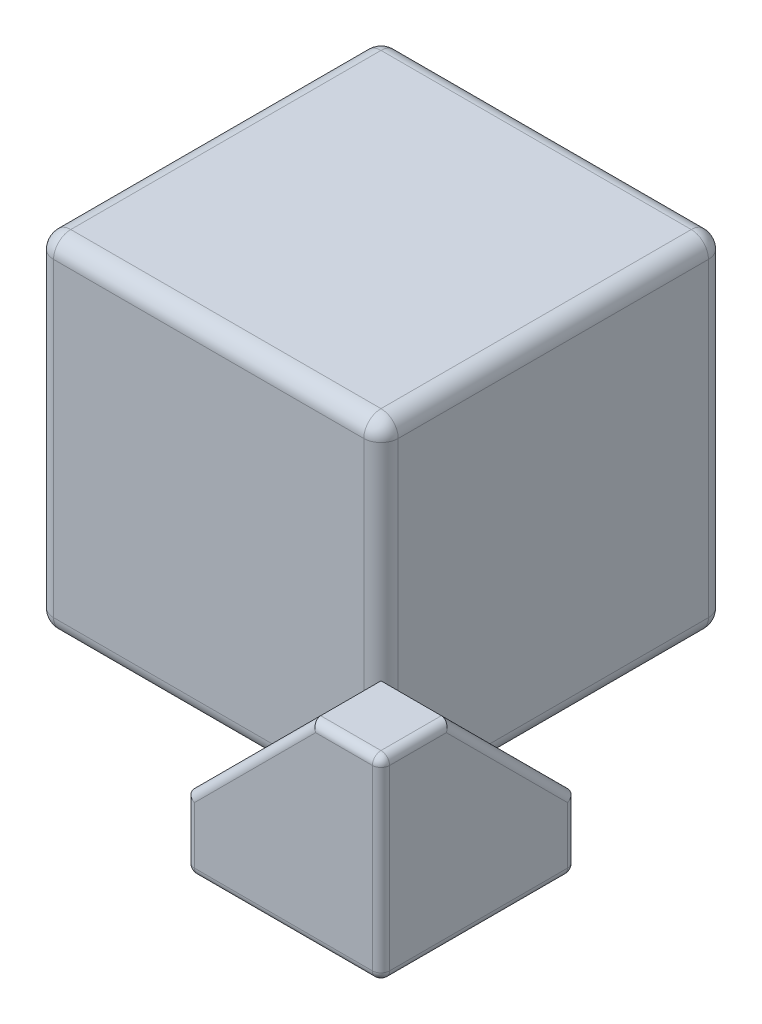
from build123d import *

# Parameters (mm, degrees)
IZIM1_W                     = 20
IZIM1_H                     = 20
Y_KSEKLIK_EKSTR_ZYON1_DEPTH = 10
BO_ALTMA1_T                 = -1
Y_KSEKLIK_EKSTR_ZYON3_DEPTH = 4
Y_KSEKLIK_EKSTR_ZYON4_DEPTH = 4
Y_KSEKLIK_EKSTR_ZYON5_REACH = 33.113
RADYUS1_R                   = 1
RADYUS2_R                   = 1
RADYUS3_R                   = 0.5
KES_EKSTR_ZYON1_DEPTH       = 3.5


with BuildPart() as part:
    # Çizim1 → Yükseklik-Ekstrüzyon1 (new, symmetric)
    with BuildSketch(Plane.XY):
        Rectangle(IZIM1_W, IZIM1_H)
    extrude(amount=Y_KSEKLIK_EKSTR_ZYON1_DEPTH, both=True)

    # İç Boşaltma1
    bo_altma1_openings = [part.faces().sort_by_distance(p)[0] for p in [
        (0, -10, 0),
    ]]
    offset(amount=BO_ALTMA1_T, openings=bo_altma1_openings, kind=Kind.INTERSECTION)

    # Çizim6 → Yükseklik-Ekstrüzyon3 (add)
    with BuildSketch(Plane(origin=(10, 0, 0), x_dir=(0, 0, -1), z_dir=(1, 0, 0))):
        Polygon((-2.679491924, -10), (-10, -2.679491924), (-10, -10), align=None)
        Polygon((-10, -10), (-10, -2.679491924), (-14, -2.679491924), (-14, -14), (-2.679491924, -14), (-2.679491924, -10), align=None)
    extrude(amount=Y_KSEKLIK_EKSTR_ZYON3_DEPTH)

    # Çizim7 → Yükseklik-Ekstrüzyon4 (add)
    with BuildSketch(Plane.XY.offset(10)):
        Polygon((10, -2.679491924), (2.679491924, -10), (2.679491924, -14), (10, -14), align=None)
    extrude(amount=Y_KSEKLIK_EKSTR_ZYON4_DEPTH)

    # Yükseklik-Ekstrüzyon5: up to this face of the body (flat: up to its plane)
    y_kseklik_ekstr_zyon5_end = Plane(part.part.faces().sort_by_distance((0, 9, 0))[0])
    # Çizim8 → Yükseklik-Ekstrüzyon5 (add, up to the picked face)
    with BuildSketch(Plane.XZ.offset(14), mode=Mode.PRIVATE) as y_kseklik_ekstr_zyon5_sk1:
        Polygon((10, 2.679491924), (2.679491924, 10), (10, 10), align=None)
    y_kseklik_ekstr_zyon5_tool1 = split(extrude(y_kseklik_ekstr_zyon5_sk1.sketch, amount=-Y_KSEKLIK_EKSTR_ZYON5_REACH, mode=Mode.PRIVATE), bisect_by=y_kseklik_ekstr_zyon5_end, keep=Keep.BOTH, mode=Mode.PRIVATE)
    add(y_kseklik_ekstr_zyon5_tool1.solids().sort_by(Axis((7.559831, -14, 7.559831), (0, 1, 0)))[0])

    # Radyus1
    # the kernel refuses this fillet: 1 mm, written as the material it takes off along each edge
    with BuildSketch(Plane(origin=(-9, 9, 9), x_dir=(0, 0, 1), z_dir=(-1, 0, 0))) as radyus1_piece_1_section:
        Polygon((0, 0), (RADYUS1_R, 0), (RADYUS1_R, RADYUS1_R), (0, RADYUS1_R), align=None)
    radyus1_piece_1 = extrude(amount=RADYUS1_R, mode=Mode.PRIVATE)
    radyus1_piece_1 = radyus1_piece_1 - Plane(origin=(-9, 9, 9), x_dir=(0, -0.7071067811865475, -0.7071067811865475), z_dir=(-1, 0, 0)) * Sphere(RADYUS1_R, mode=Mode.PRIVATE)
    add(radyus1_piece_1, mode=Mode.SUBTRACT)
    with BuildSketch(Plane(origin=(9, 9, 9), x_dir=(1, 0, 0), z_dir=(0, 0, 1))) as radyus1_piece_2_section:
        Polygon((0, 0), (RADYUS1_R, 0), (RADYUS1_R, RADYUS1_R), (0, RADYUS1_R), align=None)
    radyus1_piece_2 = extrude(amount=RADYUS1_R, mode=Mode.PRIVATE)
    radyus1_piece_2 = radyus1_piece_2 - Plane(origin=(9, 9, 9), x_dir=(-0.7071067811865475, -0.7071067811865475, 0), z_dir=(0, 0, 1)) * Sphere(RADYUS1_R, mode=Mode.PRIVATE)
    add(radyus1_piece_2, mode=Mode.SUBTRACT)
    with BuildSketch(Plane(origin=(-9, 9, -9), x_dir=(0, 1, 0), z_dir=(-1, 0, 0))) as radyus1_piece_3_section:
        Polygon((0, 0), (RADYUS1_R, 0), (RADYUS1_R, RADYUS1_R), (0, RADYUS1_R), align=None)
    radyus1_piece_3 = extrude(amount=RADYUS1_R, mode=Mode.PRIVATE)
    radyus1_piece_3 = radyus1_piece_3 - Plane(origin=(-9, 9, -9), x_dir=(0, -0.7071067811865475, 0.7071067811865475), z_dir=(-1, 0, 0)) * Sphere(RADYUS1_R, mode=Mode.PRIVATE)
    add(radyus1_piece_3, mode=Mode.SUBTRACT)
    with BuildSketch(Plane(origin=(9, 9, -9), x_dir=(1, 0, 0), z_dir=(0, 1, 0))) as radyus1_piece_4_section:
        Polygon((0, 0), (RADYUS1_R, 0), (RADYUS1_R, RADYUS1_R), (0, RADYUS1_R), align=None)
    radyus1_piece_4 = extrude(amount=RADYUS1_R, mode=Mode.PRIVATE)
    radyus1_piece_4 = radyus1_piece_4 - Plane(origin=(9, 9, -9), x_dir=(-0.7071067811865475, 0, 0.7071067811865475), z_dir=(0, 1, 0)) * Sphere(RADYUS1_R, mode=Mode.PRIVATE)
    add(radyus1_piece_4, mode=Mode.SUBTRACT)
    with BuildSketch(Plane(origin=(-10, 9, 10), x_dir=(0, 0, -1), z_dir=(0, -1, 0))) as radyus1_piece_5:
        with BuildLine():
            CenterArc((RADYUS1_R, RADYUS1_R), RADYUS1_R, 180, 90)
            Line((0, RADYUS1_R), (0, 0))
            Line((0, 0), (RADYUS1_R, 0))
        make_face()
    extrude(amount=21.5, mode=Mode.SUBTRACT)
    with BuildSketch(Plane(origin=(10, -5.179491924, 10), x_dir=(0, 0, -1), z_dir=(0, 1, 0))) as radyus1_piece_6_section:
        with BuildLine():
            CenterArc((RADYUS1_R, RADYUS1_R), RADYUS1_R, 180, 90)
            Line((0, RADYUS1_R), (0, 0))
            Line((0, 0), (RADYUS1_R, 0))
        make_face()
    radyus1_piece_6 = extrude(amount=14.179491924, mode=Mode.PRIVATE)
    radyus1_piece_6 = split(radyus1_piece_6, bisect_by=Plane(origin=(9.471072473, -2.843960274, 9.83553165), z_dir=(0, -0.7071067811865475, 0.7071067811865477)), keep=Keep.TOP, mode=Mode.PRIVATE)
    radyus1_piece_6 = split(radyus1_piece_6, bisect_by=Plane(origin=(9.592558865, -3.086933059, 9.957018042), z_dir=(-0.7071067811865479, 0.7071067811865472, 0)), keep=Keep.TOP, mode=Mode.PRIVATE)
    add(radyus1_piece_6, mode=Mode.SUBTRACT)
    with BuildSketch(Plane(origin=(10, -5.179491924, 10), x_dir=(0, 0, -1), z_dir=(0, 1, 0))) as radyus1_piece_7_section:
        with BuildLine():
            CenterArc((RADYUS1_R, RADYUS1_R), RADYUS1_R, 180, 90)
            Line((0, RADYUS1_R), (0, 0))
            Line((0, 0), (RADYUS1_R, 0))
        make_face()
    radyus1_piece_7 = extrude(amount=14.179491924, mode=Mode.PRIVATE)
    radyus1_piece_7 = split(radyus1_piece_7, bisect_by=Plane(origin=(9.957018042, -3.086933059, 9.592558865), z_dir=(0, 0.7071067811865475, -0.7071067811865477)), keep=Keep.TOP, mode=Mode.PRIVATE)
    radyus1_piece_7 = split(radyus1_piece_7, bisect_by=Plane(origin=(9.83553165, -2.843960274, 9.471072473), z_dir=(0.7071067811865479, -0.7071067811865472, 0)), keep=Keep.TOP, mode=Mode.PRIVATE)
    add(radyus1_piece_7, mode=Mode.SUBTRACT)
    with BuildSketch(Plane(origin=(10, -5.179491924, 10), x_dir=(0, 0, -1), z_dir=(0, 1, 0))) as radyus1_piece_8_section:
        with BuildLine():
            CenterArc((RADYUS1_R, RADYUS1_R), RADYUS1_R, 180, 90)
            Line((0, RADYUS1_R), (0, 0))
            Line((0, 0), (RADYUS1_R, 0))
        make_face()
    radyus1_piece_8 = extrude(amount=14.179491924, mode=Mode.PRIVATE)
    radyus1_piece_8 = split(radyus1_piece_8, bisect_by=Plane(origin=(9.773566739, 0.108490737, 12.787982661), z_dir=(0, 0.7071067811865475, -0.7071067811865477)), keep=Keep.TOP, mode=Mode.PRIVATE)
    radyus1_piece_8 = split(radyus1_piece_8, bisect_by=Plane(origin=(12.787982661, 0.108490737, 9.773566739), z_dir=(-0.7071067811865479, 0.7071067811865472, 0)), keep=Keep.TOP, mode=Mode.PRIVATE)
    add(radyus1_piece_8, mode=Mode.SUBTRACT)
    with BuildSketch(Plane(origin=(-10, 9, -10), x_dir=(0, 0, 1), z_dir=(0, -1, 0)), Plane(origin=(10, -12.5, -10), x_dir=(0, 0, 1), z_dir=(0, 1, 0))) as radyus1_piece_9:
        with BuildLine():
            CenterArc((RADYUS1_R, -RADYUS1_R), RADYUS1_R, 90, 90)
            Line((0, -RADYUS1_R), (0, 0))
            Line((0, 0), (RADYUS1_R, 0))
        make_face()
    extrude(amount=21.5, mode=Mode.SUBTRACT)
    with BuildSketch(Plane(origin=(9, 10, -10), x_dir=(0, 0, 1), z_dir=(-1, 0, 0)), Plane(origin=(-10, 10, 9), x_dir=(0, -1, 0), z_dir=(0, 0, -1))) as radyus1_piece_10:
        with BuildLine():
            CenterArc((RADYUS1_R, -RADYUS1_R), RADYUS1_R, 90, 90)
            Line((0, -RADYUS1_R), (0, 0))
            Line((0, 0), (RADYUS1_R, 0))
        make_face()
    extrude(amount=18, mode=Mode.SUBTRACT)
    with BuildSketch(Plane(origin=(9, 10, 10), x_dir=(0, 0, -1), z_dir=(-1, 0, 0)), Plane(origin=(10, 10, -9), x_dir=(-1, 0, 0), z_dir=(0, 0, 1))) as radyus1_piece_11:
        with BuildLine():
            CenterArc((RADYUS1_R, RADYUS1_R), RADYUS1_R, 180, 90)
            Line((0, RADYUS1_R), (0, 0))
            Line((0, 0), (RADYUS1_R, 0))
        make_face()
    extrude(amount=18, mode=Mode.SUBTRACT)

    # Radyus2
    # the kernel refuses this fillet: 1 mm, written as the material it takes off along each edge
    with BuildSketch(Plane(origin=(-9, -10, 10), x_dir=(0, 0, -1), z_dir=(1, 0, 0))) as radyus2_piece_1_section:
        with BuildLine():
            CenterArc((RADYUS2_R, RADYUS2_R), RADYUS2_R, 180, 90)
            Line((0, RADYUS2_R), (0, 0))
            Line((0, 0), (RADYUS2_R, 0))
        make_face()
    radyus2_piece_1 = extrude(amount=14.179491924, mode=Mode.PRIVATE)
    radyus2_piece_1 = split(radyus2_piece_1, bisect_by=Plane(origin=(-0.108490737, -9.773566739, 12.787982661), z_dir=(-0.7071067811865476, 0, -0.7071067811865475)), keep=Keep.TOP, mode=Mode.PRIVATE)
    radyus2_piece_1 = split(radyus2_piece_1, bisect_by=Plane(origin=(-0.108490737, -12.787982661, 9.773566739), z_dir=(-0.7071067811865479, 0.7071067811865472, 0)), keep=Keep.TOP, mode=Mode.PRIVATE)
    add(radyus2_piece_1, mode=Mode.SUBTRACT)
    with BuildSketch(Plane(origin=(-9, -10, 10), x_dir=(0, 0, -1), z_dir=(1, 0, 0))) as radyus2_piece_2_section:
        with BuildLine():
            CenterArc((RADYUS2_R, RADYUS2_R), RADYUS2_R, 180, 90)
            Line((0, RADYUS2_R), (0, 0))
            Line((0, 0), (RADYUS2_R, 0))
        make_face()
    radyus2_piece_2 = extrude(amount=14.179491924, mode=Mode.PRIVATE)
    radyus2_piece_2 = split(radyus2_piece_2, bisect_by=Plane(origin=(2.843960274, -9.471072473, 9.83553165), z_dir=(0.7071067811865476, 0, 0.7071067811865475)), keep=Keep.TOP, mode=Mode.PRIVATE)
    radyus2_piece_2 = split(radyus2_piece_2, bisect_by=Plane(origin=(3.086933059, -9.592558865, 9.957018042), z_dir=(-0.7071067811865479, 0.7071067811865472, 0)), keep=Keep.TOP, mode=Mode.PRIVATE)
    add(radyus2_piece_2, mode=Mode.SUBTRACT)
    with BuildSketch(Plane(origin=(-9, -10, 10), x_dir=(0, 0, -1), z_dir=(1, 0, 0))) as radyus2_piece_3_section:
        with BuildLine():
            CenterArc((RADYUS2_R, RADYUS2_R), RADYUS2_R, 180, 90)
            Line((0, RADYUS2_R), (0, 0))
            Line((0, 0), (RADYUS2_R, 0))
        make_face()
    radyus2_piece_3 = extrude(amount=14.179491924, mode=Mode.PRIVATE)
    radyus2_piece_3 = split(radyus2_piece_3, bisect_by=Plane(origin=(3.086933059, -9.957018042, 9.592558865), z_dir=(-0.7071067811865476, 0, -0.7071067811865475)), keep=Keep.TOP, mode=Mode.PRIVATE)
    radyus2_piece_3 = split(radyus2_piece_3, bisect_by=Plane(origin=(2.843960274, -9.83553165, 9.471072473), z_dir=(0.7071067811865479, -0.7071067811865472, 0)), keep=Keep.TOP, mode=Mode.PRIVATE)
    add(radyus2_piece_3, mode=Mode.SUBTRACT)
    with BuildSketch(Plane(origin=(-9, -10, 9), x_dir=(-1, 0, 0), z_dir=(0, 0, -1))) as radyus2_piece_4:
        with BuildLine():
            CenterArc((1 - RADYUS2_R, RADYUS2_R), RADYUS2_R, 270, 90)
            Line((1 - RADYUS2_R, 0), (1, 0))
            Line((1, 0), (1, RADYUS2_R))
        make_face()
    revolve(axis=Axis((-9, -10, 9), (0, 1, 0)), revolution_arc=90, mode=Mode.SUBTRACT)
    with BuildSketch(Plane(origin=(-10, -10, 9), x_dir=(0, 1, 0), z_dir=(0, 0, -1))) as radyus2_piece_5:
        with BuildLine():
            CenterArc((RADYUS2_R, RADYUS2_R), RADYUS2_R, 180, 90)
            Line((0, RADYUS2_R), (0, 0))
            Line((0, 0), (RADYUS2_R, 0))
        make_face()
    extrude(amount=18, mode=Mode.SUBTRACT)
    with BuildSketch(Plane(origin=(-9, -10, -9), x_dir=(0, 0, -1), z_dir=(1, 0, 0))) as radyus2_piece_6:
        with BuildLine():
            CenterArc((1 - RADYUS2_R, RADYUS2_R), RADYUS2_R, 270, 90)
            Line((1, RADYUS2_R), (1, 0))
            Line((1, 0), (1 - RADYUS2_R, 0))
        make_face()
    revolve(axis=Axis((-9, -10, -9), (0, 1, 0)), revolution_arc=90, mode=Mode.SUBTRACT)
    with BuildSketch(Plane(origin=(-9, -10, -10), x_dir=(0, 0, 1), z_dir=(1, 0, 0))) as radyus2_piece_7:
        with BuildLine():
            CenterArc((RADYUS2_R, -RADYUS2_R), RADYUS2_R, 90, 90)
            Line((0, -RADYUS2_R), (0, 0))
            Line((0, 0), (RADYUS2_R, 0))
        make_face()
    extrude(amount=18, mode=Mode.SUBTRACT)
    with BuildSketch(Plane(origin=(9, -10, -9), x_dir=(0, 0, -1), z_dir=(-1, 0, 0))) as radyus2_piece_8:
        with BuildLine():
            CenterArc((1 - RADYUS2_R, -RADYUS2_R), RADYUS2_R, 0, 90)
            Line((1, -RADYUS2_R), (1, 0))
            Line((1, 0), (1 - RADYUS2_R, 0))
        make_face()
    revolve(axis=Axis((9, -10, -9), (0, -1, 0)), revolution_arc=90, mode=Mode.SUBTRACT)
    with BuildSketch(Plane(origin=(10, -10, -9), x_dir=(-1, 0, 0), z_dir=(0, 0, 1))) as radyus2_piece_9_section:
        with BuildLine():
            CenterArc((RADYUS2_R, -RADYUS2_R), RADYUS2_R, 90, 90)
            Line((0, -RADYUS2_R), (0, 0))
            Line((0, 0), (RADYUS2_R, 0))
        make_face()
    radyus2_piece_9 = extrude(amount=14.179491924, mode=Mode.PRIVATE)
    radyus2_piece_9 = split(radyus2_piece_9, bisect_by=Plane(origin=(12.787982661, -9.773566739, -0.108490737), z_dir=(-0.7071067811865476, 0, -0.7071067811865475)), keep=Keep.TOP, mode=Mode.PRIVATE)
    radyus2_piece_9 = split(radyus2_piece_9, bisect_by=Plane(origin=(9.773566739, -12.787982661, -0.108490737), z_dir=(0, 0.7071067811865475, -0.7071067811865477)), keep=Keep.TOP, mode=Mode.PRIVATE)
    add(radyus2_piece_9, mode=Mode.SUBTRACT)
    with BuildSketch(Plane(origin=(10, -10, -9), x_dir=(-1, 0, 0), z_dir=(0, 0, 1))) as radyus2_piece_10_section:
        with BuildLine():
            CenterArc((RADYUS2_R, -RADYUS2_R), RADYUS2_R, 90, 90)
            Line((0, -RADYUS2_R), (0, 0))
            Line((0, 0), (RADYUS2_R, 0))
        make_face()
    radyus2_piece_10 = extrude(amount=14.179491924, mode=Mode.PRIVATE)
    radyus2_piece_10 = split(radyus2_piece_10, bisect_by=Plane(origin=(9.83553165, -9.471072473, 2.843960274), z_dir=(0.7071067811865476, 0, 0.7071067811865475)), keep=Keep.TOP, mode=Mode.PRIVATE)
    radyus2_piece_10 = split(radyus2_piece_10, bisect_by=Plane(origin=(9.957018042, -9.592558865, 3.086933059), z_dir=(0, 0.7071067811865475, -0.7071067811865477)), keep=Keep.TOP, mode=Mode.PRIVATE)
    add(radyus2_piece_10, mode=Mode.SUBTRACT)
    with BuildSketch(Plane(origin=(10, -10, -9), x_dir=(-1, 0, 0), z_dir=(0, 0, 1))) as radyus2_piece_11_section:
        with BuildLine():
            CenterArc((RADYUS2_R, -RADYUS2_R), RADYUS2_R, 90, 90)
            Line((0, -RADYUS2_R), (0, 0))
            Line((0, 0), (RADYUS2_R, 0))
        make_face()
    radyus2_piece_11 = extrude(amount=14.179491924, mode=Mode.PRIVATE)
    radyus2_piece_11 = split(radyus2_piece_11, bisect_by=Plane(origin=(9.592558865, -9.957018042, 3.086933059), z_dir=(-0.7071067811865476, 0, -0.7071067811865475)), keep=Keep.TOP, mode=Mode.PRIVATE)
    radyus2_piece_11 = split(radyus2_piece_11, bisect_by=Plane(origin=(9.471072473, -9.83553165, 2.843960274), z_dir=(0, -0.7071067811865475, 0.7071067811865477)), keep=Keep.TOP, mode=Mode.PRIVATE)
    add(radyus2_piece_11, mode=Mode.SUBTRACT)

    # Radyus3
    radyus3_edges = [part.edges().sort_by_distance(p)[0] for p in [
        (14, -6.339745962, 6.339745962),
        (12, -2.679491924, 14),
        (8.339745962, -14, 14),
        (14, -12, 2.679491924),
        (12, -14, 2.679491924),
        (14, -2.679491924, 12),
        (14, -8.339745962, 14),
        (14, -14, 8.339745962),
        (2.679491924, -14, 12),
        (6.339745962, -6.339745962, 14),
        (2.679491924, -12, 14),
        (6.339745962, -14, 6.339745962),
    ]]
    fillet(radyus3_edges, radius=RADYUS3_R)

    # Çizim9 → Kes-Ekstrüzyon1 (cut)
    with BuildSketch(Plane.XZ.offset(14)):
        Polygon((12.5, 4.179491924), (12.5, 12.5), (4.179491924, 12.5), (4.179491924, 10.621320344), (10.621320344, 4.179491924), align=None)
    extrude(amount=-KES_EKSTR_ZYON1_DEPTH, mode=Mode.SUBTRACT)


solid = part.part
